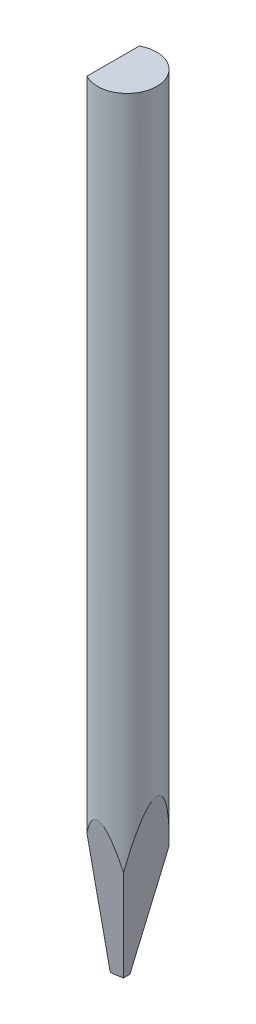
from build123d import *

# Parameters (mm, degrees)
TD_SKETCH_R                   = 0.79248
TL_FEATURE_DEPTH              = 21.0312
TDF_STD_SKETCH_W              = 1.60495996
TDF_STD_SKETCH_H              = 1.60495996
TDF_STD_FEATURE_DEPTH         = 22.061040395
ISA_20_STD_FEATURE_DEPTH      = 22.061040395
ISA_20_STD_FEATURE_DEPTH_BACK = 22.061040395
F_10BA_STD_FEATURE_DEPTH      = 22.061040395
F_10BA_STD_FEATURE_DEPTH_BACK = 22.061040395
FRO_STD_FEATURE_DEPTH         = 22.061040395
FRO_STD_FEATURE_DEPTH_BACK    = 22.061040395


with BuildPart() as part:
    # TD_sketch → TL_feature (new body)
    with BuildSketch(Plane(origin=(0, 0, 0), x_dir=(1, 0, 0), z_dir=(0, 1, 0))):
        Circle(TD_SKETCH_R)
    extrude(amount=TL_FEATURE_DEPTH)

    # TDF_STD_sketch → TDF_STD_feature (cut, through all)
    with BuildSketch(Plane(origin=(0, 0, 0), x_dir=(1, 0, 0), z_dir=(0, 1, 0))):
        with Locations((-1.17839998, 0)):
            Rectangle(TDF_STD_SKETCH_W, TDF_STD_SKETCH_H)
    extrude(amount=TDF_STD_FEATURE_DEPTH, mode=Mode.SUBTRACT)

    # ISA_20_STD_sketch → ISA_20_STD_feature (cut, two sides: drawn at the far end of the back side and taken through both)
    with BuildSketch(Plane(origin=(0, 0, 0), x_dir=(0, 0, -1), z_dir=(1, 0, 0)).offset(-ISA_20_STD_FEATURE_DEPTH_BACK)):
        Polygon((-12.996080373, 73.27228267), (-3.784567997, 21.0312), (-0.0762, 0), (0.0762, 0), (3.784567997, 21.0312), (12.996080373, 73.27228267), (12.996080373, -32.821688483), (-12.996080373, -32.821688483), align=None)
    extrude(amount=ISA_20_STD_FEATURE_DEPTH + ISA_20_STD_FEATURE_DEPTH_BACK, mode=Mode.SUBTRACT)

    # 10BA_STD_sketch → 10BA_STD_feature (cut, two sides: drawn at the far end of the back side and taken through both)
    with BuildSketch(Plane.XY.offset(-F_10BA_STD_FEATURE_DEPTH_BACK)):
        Polygon((-53.216424634, 0), (-0.37592, 0), (-0.29972, 0), (-0.011354365, 0.050846642), (3.688047997, 21.0312), (12.863705333, 73.068938636), (91.245889802, 2.18375769), (25.165759835, -70.885180946), align=None)
    extrude(amount=F_10BA_STD_FEATURE_DEPTH + F_10BA_STD_FEATURE_DEPTH_BACK, mode=Mode.SUBTRACT)

    # FRO_STD_sketch → FRO_STD_feature (cut, two sides: drawn at the far end of the back side and taken through both)
    with BuildSketch(Plane.XY.offset(-FRO_STD_FEATURE_DEPTH_BACK)):
        with BuildLine():
            Line((-0.3760216, 52.152149391), (-0.3760216, 0.02794))
            ThreePointArc((-0.3760216, 0.02794), (-0.367838163, 0.008183437), (-0.3480816, 0))
            Line((-0.3480816, 0), (51.776127791, 0))
            Line((51.776127791, 0), (-21.938636058, -73.714763849))
            Line((-21.938636058, -73.714763849), (-74.090785449, -21.562614458))
            Line((-74.090785449, -21.562614458), (-0.3760216, 52.152149391))
        make_face()
    extrude(amount=FRO_STD_FEATURE_DEPTH + FRO_STD_FEATURE_DEPTH_BACK, mode=Mode.SUBTRACT)


solid = part.part
